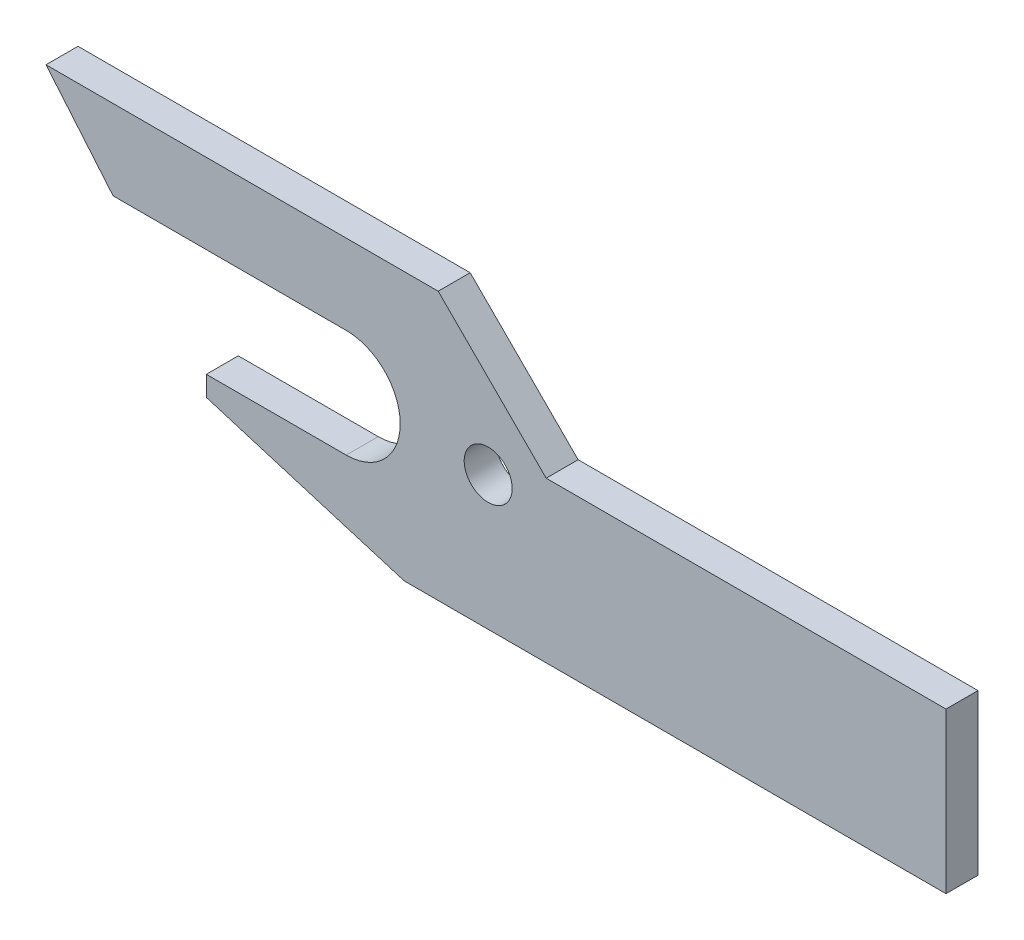
from build123d import *

# Parameters (mm, degrees)
SKETCH_1_R             = 6
SM_BASE_FLANGE_1_DEPTH = 8


# Sheet-metal steps are written as plain solids
with BuildPart() as part:
    # Sketch 1 → Базовая кромка1 (new body)
    with BuildSketch(Plane.XY):
        with BuildLine():
            Line((-35, -13.5), (0, -13.5))
            ThreePointArc((0, -13.5), (13.5, 0), (0, 13.5))
            Line((0, 13.5), (-58.308631084, 13.5))
            Line((-58.308631084, 13.5), (-75.090623708, 33.5))
            Line((-75.090623708, 33.5), (23, 33.5))
            Line((23, 33.5), (50, 6.5))
            Line((50, 6.5), (150, 6.5))
            Line((150, 6.5), (150, -33.5))
            Line((150, -33.5), (14.5, -33.5))
            Line((14.5, -33.5), (-35, -18.5))
            Line((-35, -18.5), (-35, -13.5))
        make_face()
        with Locations((35.5, 0)):
            Circle(SKETCH_1_R, mode=Mode.SUBTRACT)
    extrude(amount=-SM_BASE_FLANGE_1_DEPTH)


solid = part.part
